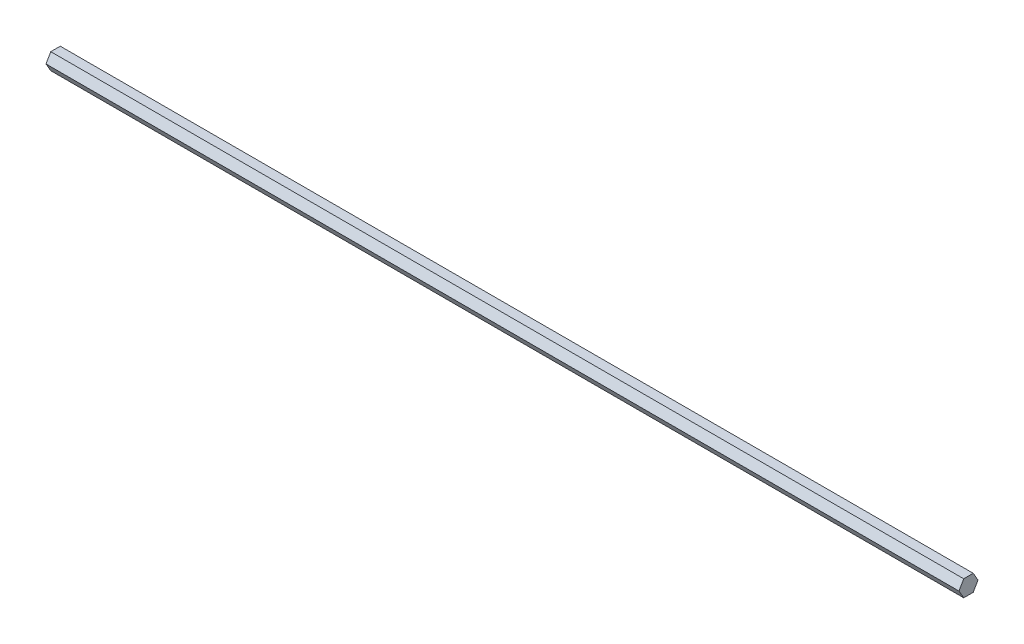
from build123d import *

# Parameters (mm, degrees)
BOSS_EXTRUDE1_DEPTH = 703.072


with BuildPart() as part:
    # Sketch1 → Boss-Extrude1 (new body)
    with BuildSketch(Plane(origin=(0, 0, 0), x_dir=(0, 0, -1), z_dir=(1, 0, 0))):
        Polygon((7.332348419, 0), (3.666174209, 6.35), (-3.666174209, 6.35), (-7.332348419, 0), (-3.666174209, -6.35), (3.666174209, -6.35), align=None)
    extrude(amount=BOSS_EXTRUDE1_DEPTH)


solid = part.part
